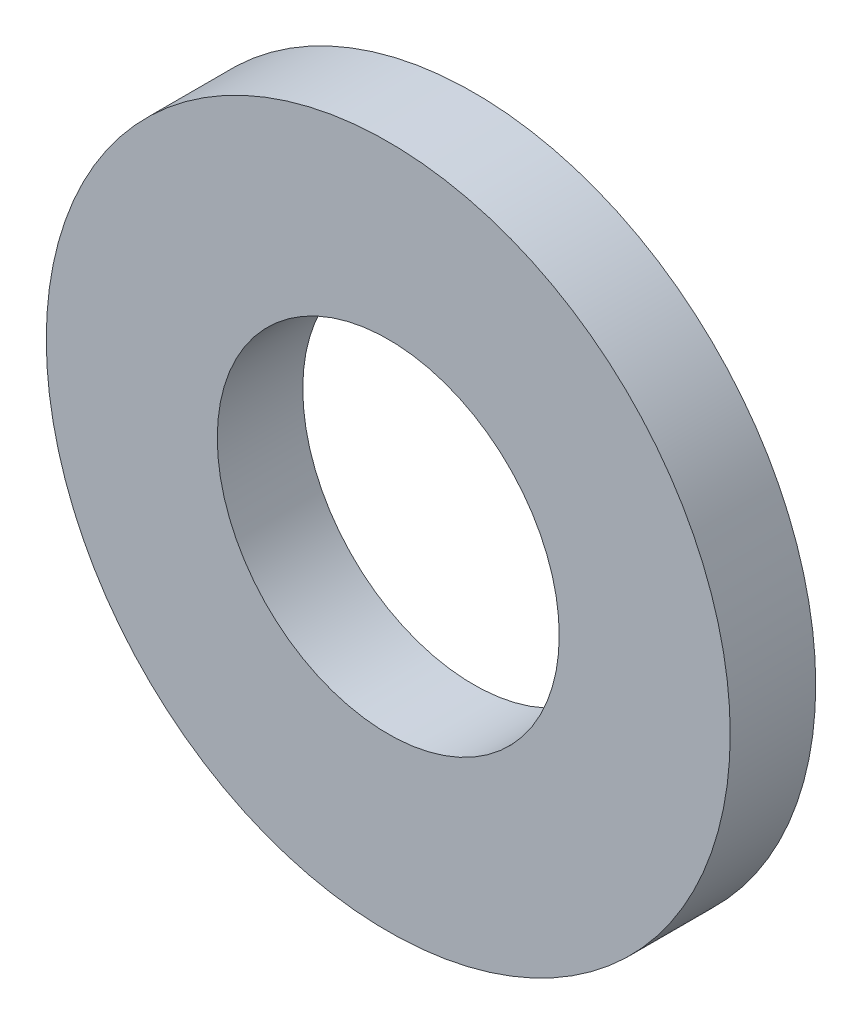
from build123d import *

# Parameters (mm, degrees)
SKETCH1_R           = 12.7
SKETCH1_R_2         = 6.35
BOSS_EXTRUDE1_DEPTH = 3.175


with BuildPart() as part:
    # Sketch1 → Boss-Extrude1 (new body)
    with BuildSketch(Plane.XY):
        Circle(SKETCH1_R)
        Circle(SKETCH1_R_2, mode=Mode.SUBTRACT)
    extrude(amount=BOSS_EXTRUDE1_DEPTH)


solid = part.part
